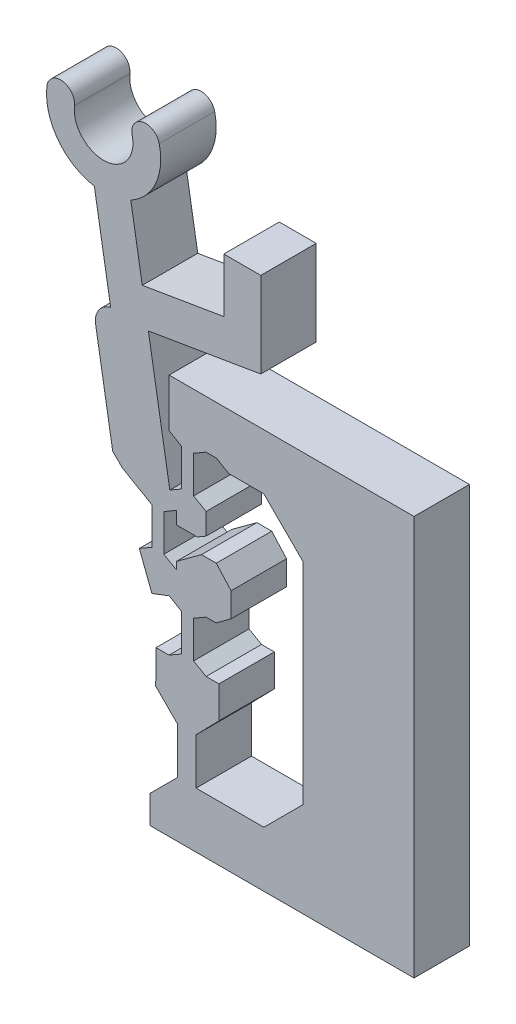
from build123d import *

# Parameters (mm, degrees)
BOSS_SWITCHMAIN_DEPTH = 3


with BuildPart() as part:
    # Sketch-SwitchBossUp → Boss-SwitchMain (new body)
    with BuildSketch(Plane.XY):
        with BuildLine():
            Line((6.540476927, 22.165014537), (6.540476927, 25.093856925))
            Line((6.540476927, 25.093856925), (8.540476927, 25.093856925))
            Line((8.540476927, 25.093856925), (8.540476927, 20.473554675))
            Line((8.540476927, 20.473554675), (2.463355023, 19.450530066))
            Line((2.463355023, 19.450530066), (3.620297651, 12.577888564))
            Line((3.620297651, 12.577888564), (4.256080915, 12.944958203))
            Line((4.256080915, 12.944958203), (4.256080915, 14.944958203))
            Line((4.256080915, 14.944958203), (3.581073513, 15.334673908))
            Line((3.581073513, 15.334673908), (3.581073513, 17.94496801))
            Line((3.581073513, 17.94496801), (6.811292922, 17.94496801))
            Line((6.811292922, 17.94496801), (16.828083018, 17.94496801))
            Line((16.828083018, 17.94496801), (16.828083018, -3.673367153))
            Line((16.828083018, -3.673367153), (5.040476927, -3.673367153))
            Line((5.040476927, -3.673367153), (2.540499132, -3.673367153))
            Line((2.540499132, -3.673367153), (2.540499132, -2.173367153))
            Line((2.540499132, -2.173367153), (4.040476927, -0.673367153))
            Line((4.040476927, -0.673367153), (4.040476927, 1.826632847))
            Line((4.040476927, 1.826632847), (2.857692557, 3.009399709))
            Line((2.857692557, 3.009399709), (2.877504246, 4.826720436))
            Line((2.877504246, 4.826720436), (3.58114552, 4.826720436))
            Line((3.58114552, 4.826720436), (4.256138119, 5.216427595))
            Line((4.256138119, 5.216427595), (4.256138119, 7.216427595))
            Line((4.256138119, 7.216427595), (3.581130717, 7.6061433))
            Line((3.581130717, 7.6061433), (2.651103927, 7.249064905))
            Line((2.651103927, 7.249064905), (1.971281627, 9.019692757))
            Line((1.971281627, 9.019692757), (2.646271341, 9.40939825))
            Line((2.646271341, 9.40939825), (2.646271341, 11.40939825))
            Line((2.646271341, 11.40939825), (1.053198631, 12.329159209))
            Line((1.053198631, 12.329159209), (0.532068352, 12.851254842))
            Line((0.532068352, 12.851254842), (-0.388805291, 18.321564484))
            ThreePointArc((-0.388805291, 18.321564484), (-0.224136417, 19.087558912), (0.421628056, 19.531238467))
            Line((0.421628056, 19.531238467), (-0.46073685, 24.772792819))
            ThreePointArc((-0.46073685, 24.772792819), (-2.424398677, 25.960025656), (-3.026553651, 28.17427473))
            ThreePointArc((-3.026553651, 28.17427473), (-2.19530667, 28.833083091), (-1.536498309, 28.001836109))
            ThreePointArc((-1.536498309, 28.001836109), (0.131578063, 26.234454713), (1.586154239, 28.18133014))
            ThreePointArc((1.586154239, 28.18133014), (2.145375848, 29.08259103), (3.046636738, 28.523369421))
            ThreePointArc((3.046636738, 28.523369421), (2.857030105, 26.554552243), (1.511513111, 25.104801997))
            Line((1.511513111, 25.104801997), (2.131345845, 21.422780026))
            Line((2.131345845, 21.422780026), (6.540476927, 22.165014537))
        make_face()
        Polygon((5.581091201, 12.555245643), (5.581099756, 11.399422818), (5.104510585, 11.124263931), (3.97126605, 11.124263931), (3.97126394, 11.79911022), (3.296271341, 11.409403061), (3.296271341, 9.409403061), (3.971278743, 9.019687356), (3.971278743, 9.409408058), (5.332971639, 10.409021979), (6.133921896, 10.409027907), (6.935397893, 9.518898634), (6.935397893, 8.203897773), (6.121118142, 7.606137899), (5.581127833, 7.606137899), (4.906138119, 7.216432406), (4.906138119, 5.216432406), (5.58114552, 4.826716701), (6.276166537, 4.826716701), (6.276166537, 3.095193505), (5.040476927, 1.826632847), (5.040476927, -0.673367153), (8.706762674, -0.673367153), (10.828083018, 1.447953191), (10.828083018, 12.823647666), (8.706762674, 14.94496801), (6.811292922, 14.94496801), (6.133921896, 15.33440512), (5.580614429, 15.33440512), (4.906080915, 14.944963014), (4.906080915, 12.944963014), align=None, mode=Mode.SUBTRACT)
    extrude(amount=BOSS_SWITCHMAIN_DEPTH)


solid = part.part
